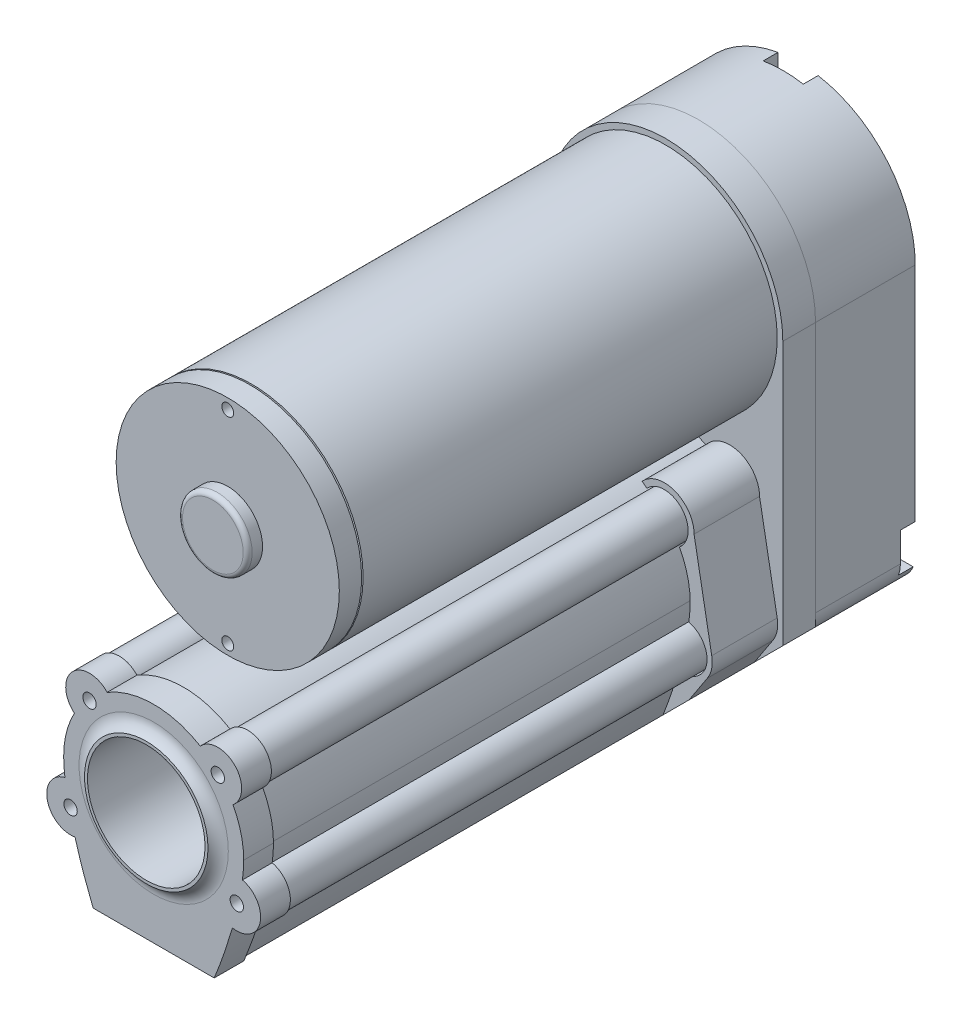
from build123d import *

# Parameters (mm, degrees)
BOSS_EXTRUDE1_DEPTH  = 8.509
BOSS_EXTRUDE3_DEPTH  = 5.588
SKETCH6_R            = 19.05
BOSS_EXTRUDE4_DEPTH  = 70.6882
CUT_EXTRUDE1_DEPTH   = 2.54
SKETCH10_R           = 10.033
BOSS_EXTRUDE6_DEPTH  = 82.313
SKETCH12_R           = 10.033
BOSS_EXTRUDE7_DEPTH  = 5.08
SKETCH14_R           = 10.541
SKETCH14_R_2         = 10.033
BOSS_EXTRUDE8_DEPTH  = 1.27
FILLET2_R            = 2.54
SKETCH16_R           = 1.143
CUT_EXTRUDE2_DEPTH   = 17.78
SKETCH17_R           = 1.143
CUT_EXTRUDE3_DEPTH   = 12.7
SKETCH19_R           = 19.05
BOSS_EXTRUDE9_DEPTH  = 3.81
SKETCH20_R           = 5.9436
BOSS_EXTRUDE10_DEPTH = 2.54
FILLET4_R            = 0.762
SKETCH24_R           = 1.016
CUT_EXTRUDE6_DEPTH   = 12.7
BOSS_EXTRUDE12_DEPTH = 11.176
CHAMFER1_SIZE        = 10
CHAMFER2_SIZE        = 10
FILLET5_R            = 5


with BuildPart() as part:
    # Sketch1 → Boss-Extrude1 (new, symmetric)
    with BuildSketch(Plane.XY):
        with BuildLine():
            Line((0, 0), (0, 55.0037))
            ThreePointArc((0, 55.0037), (20.0025, 75.0062), (40.005, 55.0037))
            Line((40.005, 55.0037), (40.005, 0))
            Line((40.005, 0), (0, 0))
        make_face()
    extrude(amount=BOSS_EXTRUDE1_DEPTH, both=True)

    # Sketch9 → Cut-Extrude1 (cut)
    with BuildSketch(Plane(origin=(0, 0, -8.509), x_dir=(-1, 0, 0), z_dir=(0, 0, -1))):
        with BuildLine():
            Line((-16.5735, 71.628), (-16.5735, 75.184))
            Line((-16.5735, 75.184), (-23.4315, 75.184))
            Line((-23.4315, 75.184), (-23.4315, 71.628))
            ThreePointArc((-23.4315, 71.628), (-20.0025, 68.199), (-16.5735, 71.628))
        make_face()
        with BuildLine():
            Line((-34.5025, 17.057), (-41.608387897, 17.057))
            Line((-41.608387897, 17.057), (-41.608387897, 10.199))
            Line((-41.608387897, 10.199), (-34.5025, 10.199))
            ThreePointArc((-34.5025, 10.199), (-31.0735, 13.628), (-34.5025, 17.057))
        make_face()
        with BuildLine():
            Line((-5.5025, 17.057), (2.637594818, 17.057))
            Line((2.637594818, 17.057), (2.637594818, 10.199))
            Line((2.637594818, 10.199), (-5.5025, 10.199))
            ThreePointArc((-5.5025, 10.199), (-8.9315, 13.628), (-5.5025, 17.057))
        make_face()
    extrude(amount=-CUT_EXTRUDE1_DEPTH, mode=Mode.SUBTRACT)

    # Sketch16 → Cut-Extrude2 (cut)
    with BuildSketch(Plane(origin=(0, 0, -5.969), x_dir=(-1, 0, 0), z_dir=(0, 0, -1))):
        with Locations((-34.5025, 13.628)):
            Circle(SKETCH16_R)
        with Locations((-5.5025, 13.628)):
            Circle(SKETCH16_R)
        with Locations((-20.0025, 71.628)):
            Circle(SKETCH16_R)
    extrude(amount=-CUT_EXTRUDE2_DEPTH, mode=Mode.SUBTRACT)

    # Chamfer1
    chamfer1_edges = [part.edges().sort_by_distance(p)[0] for p in [
        (0, 0, 0),
        (40.005, 0, 0),
    ]]
    chamfer(chamfer1_edges, length=CHAMFER1_SIZE)

    # Fillet5
    fillet5_edges = [part.edges().sort_by_distance(p)[0] for p in [
        (0, 10, 0),
        (10, 0, 0),
        (40.005, 10, 0),
        (30.005, 0, 0),
    ]]
    fillet(fillet5_edges, radius=FILLET5_R)


with BuildPart() as body_2:
    # Sketch5 → Boss-Extrude3 (new body)
    with BuildSketch(Plane.XY.offset(8.509)):
        with BuildLine():
            Line((0, 0), (0, 55.0037))
            ThreePointArc((0, 55.0037), (20.0025, 75.0062), (40.005, 55.0037))
            Line((40.005, 55.0037), (40.005, 0))
            Line((40.005, 0), (0, 0))
        make_face()
    extrude(amount=BOSS_EXTRUDE3_DEPTH)

    # Sketch6 → Boss-Extrude4 (add)
    with BuildSketch(Plane.XY.offset(14.097)):
        with Locations((20.0025, 55.0037)):
            Circle(SKETCH6_R)
    extrude(amount=BOSS_EXTRUDE4_DEPTH)

    # Sketch10 → Boss-Extrude6 (add)
    with BuildSketch(Plane.XY.offset(14.097)):
        with BuildLine():
            Line((9.8425, 0), (30.1625, 0))
            add(Edge.make_bspline(
                [(30.1625, 0), (31.226301023, 2.609741166), (32.348681597, 5.792679084), (33.255604951, 9.006678218)],
                knots=[0, 0, 0, 0, 0.457098063, 0.457098063, 0.457098063, 0.457098063], degree=3))
            ThreePointArc((33.255604951, 9.006678218), (37.914560546, 11.891774837), (34.871100982, 16.448857634))
            add(Edge.make_bspline(
                [(34.871100982, 16.448857634), (35.01780023, 17.541927309), (35.110432217, 18.623570018), (35.1155, 19.634472975), (35.1155, 19.685)],
                knots=[0.819985001, 0.819985001, 0.819985001, 0.819985001, 0.99099925, 1, 1, 1, 1], degree=3))
            ThreePointArc((35.1155, 19.685), (34.631663976, 23.478458891), (33.211135498, 27.029025958))
            ThreePointArc((33.211135498, 27.029025958), (33.71579816, 32.724378151), (28.002260088, 32.507114004))
            ThreePointArc((28.002260088, 32.507114004), (20.0025, 34.798), (12.002739912, 32.507114004))
            ThreePointArc((12.002739912, 32.507114004), (6.28920184, 32.724378151), (6.793864502, 27.029025958))
            ThreePointArc((6.793864502, 27.029025958), (5.373336024, 23.478458891), (4.8895, 19.685))
            add(Edge.make_bspline(
                [(5.133899018, 16.448857634), (4.98719977, 17.541927309), (4.894567783, 18.623570018), (4.8895, 19.634472975), (4.8895, 19.685)],
                knots=[0.819985001, 0.819985001, 0.819985001, 0.819985001, 0.99099925, 1, 1, 1, 1], degree=3))
            ThreePointArc((5.133899018, 16.448857634), (2.090439454, 11.891774837), (6.749395049, 9.006678218))
            add(Edge.make_bspline(
                [(9.8425, 0), (8.778698977, 2.609741166), (7.656318403, 5.792679084), (6.749395049, 9.006678218)],
                knots=[0, 0, 0, 0, 0.457098063, 0.457098063, 0.457098063, 0.457098063], degree=3))
        make_face()
        with Locations((20.0025, 19.685)):
            Circle(SKETCH10_R, mode=Mode.SUBTRACT)
    extrude(amount=BOSS_EXTRUDE6_DEPTH)

    # Sketch12 → Boss-Extrude7 (add)
    with BuildSketch(Plane.XY.offset(96.41)):
        with BuildLine():
            Line((9.671745512, -0.254), (30.333254488, -0.254))
            add(Edge.make_bspline(
                [(30.333254488, -0.254), (30.631718797, 0.478199517), (30.921565676, 1.213771591), (31.478215598, 2.693934282), (31.746403487, 3.437731975), (32.521886949, 5.679397001), (33.000455536, 7.186360703), (33.434596649, 8.707064076)],
                knots=[0, 0, 0, 0, 0.25, 0.25, 0.5, 0.5, 1, 1, 1, 1], degree=3))
            ThreePointArc((33.434596649, 8.707064076), (38.163303677, 11.840310383), (35.153400776, 16.648468772))
            add(Edge.make_bspline(
                [(35.153400776, 16.648468772), (35.281920122, 17.655861208), (35.3695, 18.66928999), (35.3695, 19.685)],
                knots=[0, 0, 0, 0, 1, 1, 1, 1], degree=3))
            ThreePointArc((35.3695, 19.685), (34.904493115, 23.436704972), (33.537614766, 26.961356043))
            ThreePointArc((33.537614766, 26.961356043), (33.899869276, 32.899403361), (27.951114087, 32.836586334))
            ThreePointArc((27.951114087, 32.836586334), (20.0025, 35.052), (12.053885913, 32.836586334))
            ThreePointArc((12.053885913, 32.836586334), (6.105130724, 32.899403361), (6.467385234, 26.961356043))
            ThreePointArc((6.467385234, 26.961356043), (5.100506885, 23.436704972), (4.6355, 19.685))
            add(Edge.make_bspline(
                [(4.6355, 19.685), (4.6355, 18.669373414), (4.723086167, 17.655811912), (4.851599224, 16.648468772)],
                knots=[0, 0, 0, 0, 1, 1, 1, 1], degree=3))
            ThreePointArc((4.851599224, 16.648468772), (1.841696323, 11.840310383), (6.570403351, 8.707064076))
            add(Edge.make_bspline(
                [(6.570403351, 8.707064076), (7.004535994, 7.186390371), (7.483291477, 5.67885043), (8.258789857, 3.437188492), (8.526975821, 2.693416931), (9.083468541, 1.213688966), (9.37327892, 0.478205116), (9.671745512, -0.254)],
                knots=[0, 0, 0, 0, 0.5, 0.5, 0.75, 0.75, 1, 1, 1, 1], degree=3))
        make_face()
        with Locations((20.0025, 19.685)):
            Circle(SKETCH12_R, mode=Mode.SUBTRACT)
    extrude(amount=BOSS_EXTRUDE7_DEPTH)

    # Sketch14 → Boss-Extrude8 (add)
    with BuildSketch(Plane.XY.offset(101.49)):
        with Locations((20.0025, 19.685)):
            Circle(SKETCH14_R)
        with Locations((20.0025, 19.685)):
            Circle(SKETCH14_R_2, mode=Mode.SUBTRACT)
    extrude(amount=BOSS_EXTRUDE8_DEPTH)

    # Fillet2
    # the kernel refuses this fillet: 2.54 mm, written as the material it adds along each edge
    with BuildSketch(Plane(origin=(20.0025, 19.685, 101.49), x_dir=(1, 0, 0), z_dir=(0, -1, 0))) as fillet2_piece_1:
        with BuildLine():
            CenterArc((12.740704526, 2.54), FILLET2_R, 210, 60)
            Line((10.541, 1.27), (10.497005909, 1.2446))
            ThreePointArc((10.497005909, 1.2446), (10.4902, 0.635), (10.4902, 0))
            Line((10.4902, 0), (10.541, -0.0508))
            Line((10.541, -0.0508), (12.740704526, -0.0508))
            Line((12.740704526, -0.0508), (12.740704526, 0))
        make_face()
    revolve(axis=Axis((20.0025, 19.685, 101.49), (0, 0, 1)))

    # Sketch17 → Cut-Extrude3 (cut)
    with BuildSketch(Plane.XY.offset(101.49)):
        with Locations((30.954731416, 30.099)):
            Circle(SKETCH17_R)
        with Locations((34.19127274, 12.7)):
            Circle(SKETCH17_R)
        with Locations((5.81372726, 12.7)):
            Circle(SKETCH17_R)
        with Locations((9.050268584, 30.099)):
            Circle(SKETCH17_R)
    extrude(amount=-CUT_EXTRUDE3_DEPTH, mode=Mode.SUBTRACT)


with BuildPart() as body_3:
    # Sketch19 → Boss-Extrude9 (new body)
    with BuildSketch(Plane.XY.offset(85.0392)):
        with Locations(Location((20.0025, 55.0037, 0), (0, 0, 180))):
            Circle(SKETCH19_R)
    extrude(amount=BOSS_EXTRUDE9_DEPTH)

    # Sketch20 → Boss-Extrude10 (add)
    with BuildSketch(Plane.XY.offset(88.8492)):
        with Locations((20.0025, 55.0037)):
            Circle(SKETCH20_R)
    extrude(amount=BOSS_EXTRUDE10_DEPTH)

    # Fillet4
    fillet4_edges = [body_3.edges().sort_by_distance(p)[0] for p in [
        (14.0589, 55.0037, 91.3892),
    ]]
    fillet(fillet4_edges, radius=FILLET4_R)


with BuildPart() as cut_extrude6_tool:
    # Sketch24 → Cut-Extrude6 (new body)
    with BuildSketch(Plane.XY.offset(88.8492)):
        with Locations((20.0025, 72.2757)):
            Circle(SKETCH24_R)
        with Locations((20.0025, 37.7317)):
            Circle(SKETCH24_R)
    extrude(amount=-CUT_EXTRUDE6_DEPTH)


with BuildPart() as body_2_1:
    add(body_2.part)

    # Cut-Extrude6: cut by cut_extrude6_tool
    add(cut_extrude6_tool.part, mode=Mode.SUBTRACT)

    # Sketch25 → Boss-Extrude12 (add)
    with BuildSketch(Plane.XY.offset(14.097)):
        with BuildLine():
            Line((30.436716454, 0), (31.779066596, 0))
            Line((31.779066596, 0), (38.298643843, 9.937971032))
            ThreePointArc((38.298643843, 9.937971032), (39.030059315, 11.716403864), (39.048039076, 13.639284166))
            Line((39.048039076, 13.639284166), (36.034731416, 30.099))
            ThreePointArc((36.034731416, 30.099), (32.778037303, 34.840514067), (27.183567777, 33.502634059))
            Line((27.183567777, 33.502634059), (27.9721266, 32.859464546))
            ThreePointArc((27.9721266, 32.859464546), (33.910550303, 32.88812723), (33.537614766, 26.961356043))
            ThreePointArc((33.537614766, 26.961356043), (34.905666392, 23.432041565), (35.36949699, 19.675382529))
            add(Edge.make_bspline(
                [(35.141757719, 16.651287677), (35.209594995, 17.166732711), (35.324312915, 18.235415469), (35.367366892, 19.183665047), (35.36949699, 19.675382529)],
                knots=[0.832741148, 0.832741148, 0.832741148, 0.832741148, 0.916061435, 1, 1, 1, 1], degree=3))
            ThreePointArc((35.141757719, 16.651287677), (38.164566417, 11.846165488), (33.434596651, 8.707064075))
            add(Edge.make_bspline(
                [(30.436716454, 0), (30.556187885, 0.294225535), (30.801789429, 0.910185259), (31.318228851, 2.25405184), (31.97439215, 4.065716636), (32.735995342, 6.352630652), (33.210644319, 7.922607002), (33.434596651, 8.707064075)],
                knots=[0.005460213, 0.005460213, 0.005460213, 0.005460213, 0.055774623, 0.111549246, 0.223098493, 0.334647739, 0.446196986, 0.446196986, 0.446196986, 0.446196986], degree=3))
        make_face()
        with BuildLine():
            Line((8.225933404, 0), (9.568283546, 0))
            add(Edge.make_bspline(
                [(9.568283546, 0), (9.448812115, 0.294225535), (9.203210571, 0.910185259), (8.686771149, 2.25405184), (8.03060785, 4.065716636), (7.269004658, 6.352630652), (6.794355681, 7.922607002), (6.570403349, 8.707064075)],
                knots=[0.005460213, 0.005460213, 0.005460213, 0.005460213, 0.055774623, 0.111549246, 0.223098493, 0.334647739, 0.446196986, 0.446196986, 0.446196986, 0.446196986], degree=3))
            ThreePointArc((6.570403349, 8.707064075), (1.840365092, 11.84648427), (4.863876319, 16.651440141))
            add(Edge.make_bspline(
                [(4.863876319, 16.651440141), (4.795376218, 17.170454447), (4.679968352, 18.243534458), (4.636755225, 19.195289273), (4.634625126, 19.687006754)],
                knots=[0.83212287, 0.83212287, 0.83212287, 0.83212287, 0.916061435, 1, 1, 1, 1], degree=3))
            ThreePointArc((4.634625126, 19.687006754), (5.09992452, 23.437975646), (6.466696616, 26.961923034))
            ThreePointArc((6.466696616, 26.961923034), (6.094755807, 32.888451599), (12.0328734, 32.859464546))
            Line((12.0328734, 32.859464546), (12.821432223, 33.502634059))
            ThreePointArc((12.821432223, 33.502634059), (7.226962697, 34.840514067), (3.970268584, 30.099))
            Line((3.970268584, 30.099), (0.956960924, 13.639284166))
            ThreePointArc((0.956960924, 13.639284166), (0.974940685, 11.716403864), (1.706356157, 9.937971032))
            Line((1.706356157, 9.937971032), (8.225933404, 0))
        make_face()
    extrude(amount=BOSS_EXTRUDE12_DEPTH)

    # Chamfer2
    chamfer2_edges = [body_2_1.edges().sort_by_distance(p)[0] for p in [
        (0, 0, 11.303),
        (40.005, 0, 11.303),
    ]]
    chamfer(chamfer2_edges, length=CHAMFER2_SIZE)


with BuildPart() as body_3_1:
    add(body_3.part)

    # Cut-Extrude6: cut by cut_extrude6_tool
    add(cut_extrude6_tool.part, mode=Mode.SUBTRACT)


solid = Compound([part.part, body_2_1.part, body_3_1.part])
